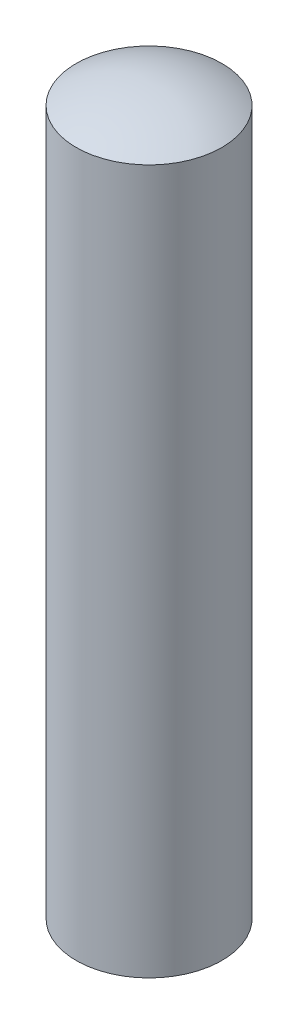
from build123d import *


with BuildPart() as part:
    # Esquisse2 → Base-Révolution (revolve)
    with BuildSketch(Plane.XY):
        with BuildLine():
            Line((0, -10), (0, 41))
            ThreePointArc((0, 41), (2.588190451, 40.659258263), (5, 39.660254038))
            Line((5, 39.660254038), (5, -8.660254038))
            ThreePointArc((5, -8.660254038), (2.588190451, -9.659258263), (0, -10))
        make_face()
    revolve(axis=Axis((0, -10, 0), (0, 1, 0)))


solid = part.part
